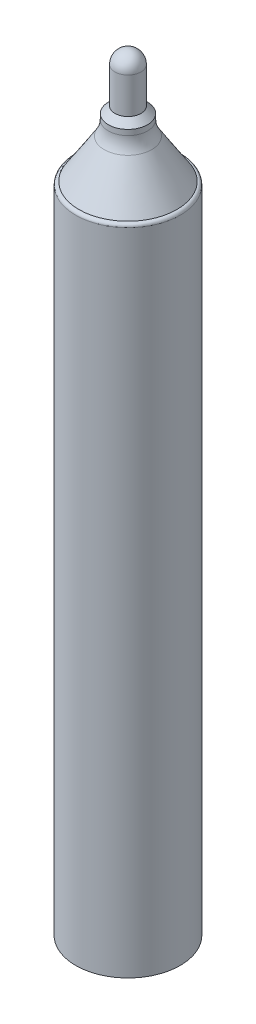
from build123d import *

# Parameters (mm, degrees)
SKETCH_1_R      = 8
EXTRUDE_1_DEPTH = 100
FILLET_1_R      = 0.5
FILLET_2_R      = 4
CHAMFER_1_SIZE  = 1


with BuildPart() as part:
    # 草图1 → 凸台-拉伸1 (new body)
    with BuildSketch(Plane(origin=(0, 0, 0), x_dir=(1, 0, 0), z_dir=(0, 1, 0))):
        with Locations(Location((0, 0, 0), (0, 0, 270))):
            Circle(SKETCH_1_R)
    extrude(amount=EXTRUDE_1_DEPTH)

    # 草图2 → 旋转1 (revolve)
    with BuildSketch(Plane.XY, mode=Mode.PRIVATE) as revolve_1_sk:
        Polygon((0, 100), (0, 110), (3, 110), (3, 107), (7.5, 100), align=None)
    revolve(revolve_1_sk.sketch.rotate(Axis((0, 100, 0), (0, -1, 0)), 180), axis=Axis((0, 100, 0), (0, -1, 0)))

    # 圆角1
    fillet_1_edges = [part.edges().sort_by_distance(p)[0] for p in [
        (0, 100, -8),
    ]]
    fillet(fillet_1_edges, radius=FILLET_1_R - 0.0001)  # a hair under: the kernel refuses the full size

    # 圆角2
    fillet_2_edges = [part.edges().sort_by_distance(p)[0] for p in [
        (3, 107, 0),
    ]]
    fillet(fillet_2_edges, radius=FILLET_2_R)

    # 草图3 → 旋转2 (revolve)
    with BuildSketch(Plane.XY, mode=Mode.PRIVATE) as revolve_2_sk:
        with BuildLine():
            Line((0, 110), (0, 117.5))
            ThreePointArc((0, 117.5), (1.414213562, 116.914213562), (2, 115.5))
            Line((2, 115.5), (2, 110))
            Line((2, 110), (0, 110))
        make_face()
    revolve(revolve_2_sk.sketch.rotate(Axis((0, 110, 0), (0, -1, 0)), 90), axis=Axis((0, 110, 0), (0, -1, 0)))

    # 倒角1
    chamfer_1_edges = [part.edges().sort_by_distance(p)[0] for p in [
        (3, 110, 0),
    ]]
    chamfer(chamfer_1_edges, length=CHAMFER_1_SIZE - 0.0001)  # a hair under: the kernel refuses the full size


solid = part.part
